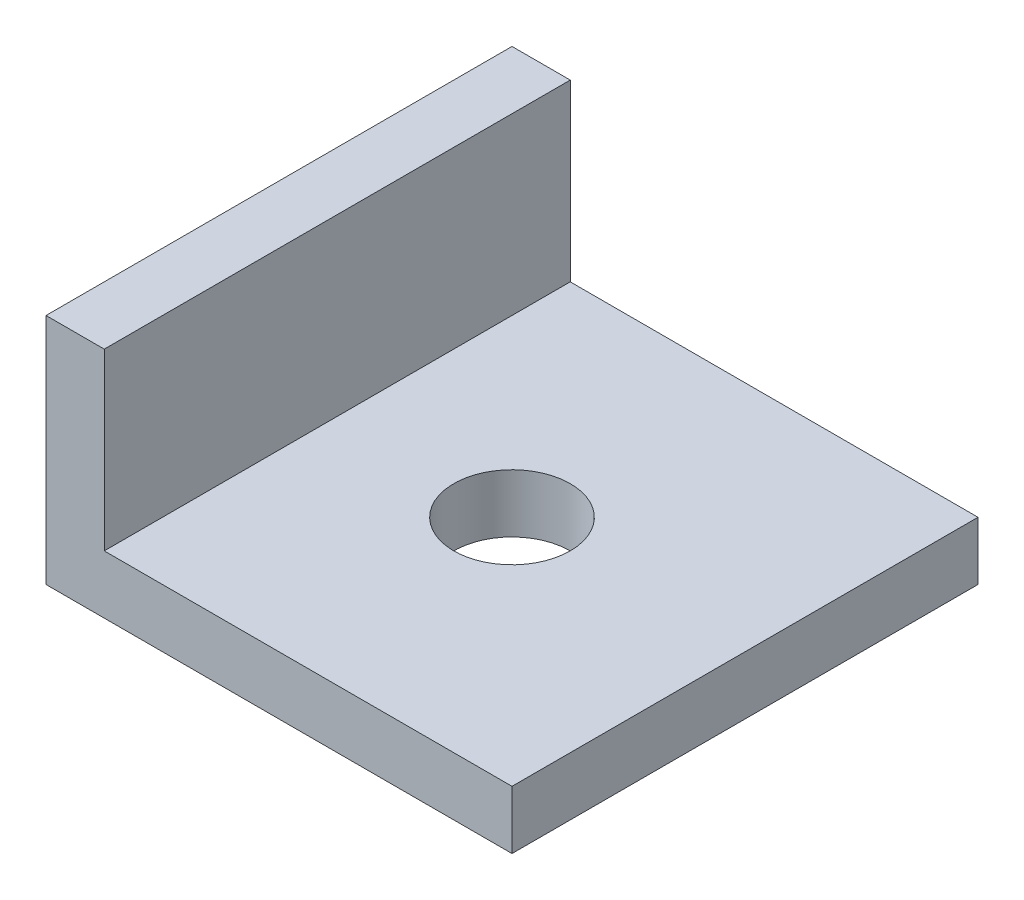
from build123d import *

# Parameters (mm, degrees)
BOSS_EXTRUDE1_DEPTH      = 25.4
BOSS_EXTRUDE1_DEPTH_BACK = 25.4
SKETCH2_W                = 50.8
SKETCH2_H                = 25.4
CUT_EXTRUDE1_DEPTH       = 77.2
CUT_EXTRUDE2_DEPTH       = 63.217039467
CUT_EXTRUDE2_DEPTH_BACK  = 63.217039467
SKETCH3_R                = 6.35


with BuildPart() as part:
    # Sketch1 → Boss-Extrude1 (new, two sides: drawn at the far end of the back side and taken through both)
    with BuildSketch(Plane.XY.offset(-BOSS_EXTRUDE1_DEPTH_BACK)):
        Polygon((0, 0), (0, 50.8), (6.35, 50.8), (6.35, 6.35), (50.8, 6.35), (50.8, 0), align=None)
    extrude(amount=BOSS_EXTRUDE1_DEPTH + BOSS_EXTRUDE1_DEPTH_BACK)

    # Sketch2 → Cut-Extrude1 (cut, through all)
    with BuildSketch(Plane.ZY):
        with Locations((0, 38.1)):
            Rectangle(SKETCH2_W, SKETCH2_H)
    extrude(amount=-CUT_EXTRUDE1_DEPTH, mode=Mode.SUBTRACT)

    # Sketch3 → Cut-Extrude2 (cut, two sides: drawn at the far end of the back side and taken through both)
    with BuildSketch(Plane.XZ.offset(-CUT_EXTRUDE2_DEPTH_BACK)):
        with Locations((25.4, 0)):
            Circle(SKETCH3_R)
    extrude(amount=CUT_EXTRUDE2_DEPTH + CUT_EXTRUDE2_DEPTH_BACK, mode=Mode.SUBTRACT)


solid = part.part
